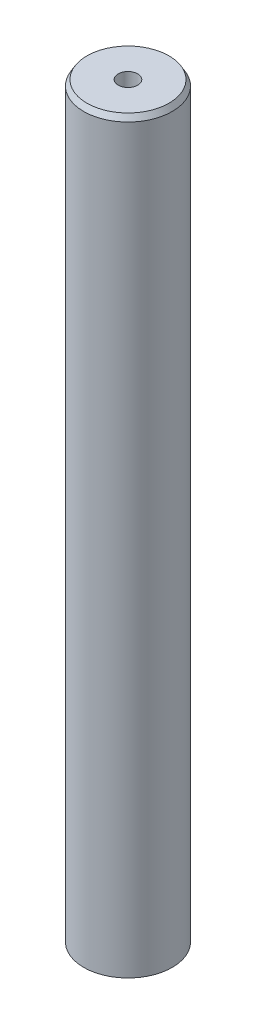
from build123d import *
from OCP.BRepFilletAPI import BRepFilletAPI_MakeChamfer

# Parameters (mm, degrees)
SKETCH1_R           = 5
BOSS_EXTRUDE1_DEPTH = 84.723237349
SKETCH2_R           = 1.106369915
CUT_EXTRUDE1_DEPTH  = 86.017803706
CHAMFER1_SIZE       = 0.6293868
CHAMFER1_SIZE2      = 0.363376639


with BuildPart() as part:
    # Sketch1 → Boss-Extrude1 (new body)
    with BuildSketch(Plane(origin=(0, 0, 0), x_dir=(1, 0, 0), z_dir=(0, 1, 0))):
        Circle(SKETCH1_R)
    extrude(amount=BOSS_EXTRUDE1_DEPTH)

    # Sketch2 → Cut-Extrude1 (cut, through all)
    with BuildSketch(Plane(origin=(0, 0, 0), x_dir=(1, 0, 0), z_dir=(0, 1, 0))):
        Circle(SKETCH2_R)
    extrude(amount=CUT_EXTRUDE1_DEPTH, mode=Mode.SUBTRACT)

    # Chamfer1: one chamfer whose edges measure the first distance from different faces: ONE call of the kernel's chamfer builder (chamfer() names one face for all edges)
    chamfer1_edges_1 = [part.edges().sort_by_distance(p)[0] for p in [
        (-5, 84.723237349, 0),
    ]]
    chamfer1_side_1 = [part.faces().sort_by_distance(p)[0] for p in [
        (-5, 42.361618675, 0),
    ]]
    chamfer1_edges_2 = [part.edges().sort_by_distance(p)[0] for p in [
        (-5, 0, 0),
    ]]
    chamfer1_side_2 = [part.faces().sort_by_distance(p)[0] for p in [
        (-4.858578644, 0, 0),
    ]]
    chamfer1 = BRepFilletAPI_MakeChamfer(part.part.solid().wrapped)
    for e in chamfer1_edges_1:
        chamfer1.Add(CHAMFER1_SIZE, CHAMFER1_SIZE2, e.wrapped, chamfer1_side_1[0].wrapped)  # the first distance lies on this face
    for e in chamfer1_edges_2:
        chamfer1.Add(CHAMFER1_SIZE, CHAMFER1_SIZE2, e.wrapped, chamfer1_side_2[0].wrapped)  # the first distance lies on this face
    add(Compound.cast(chamfer1.Shape()), mode=Mode.REPLACE)


solid = part.part
